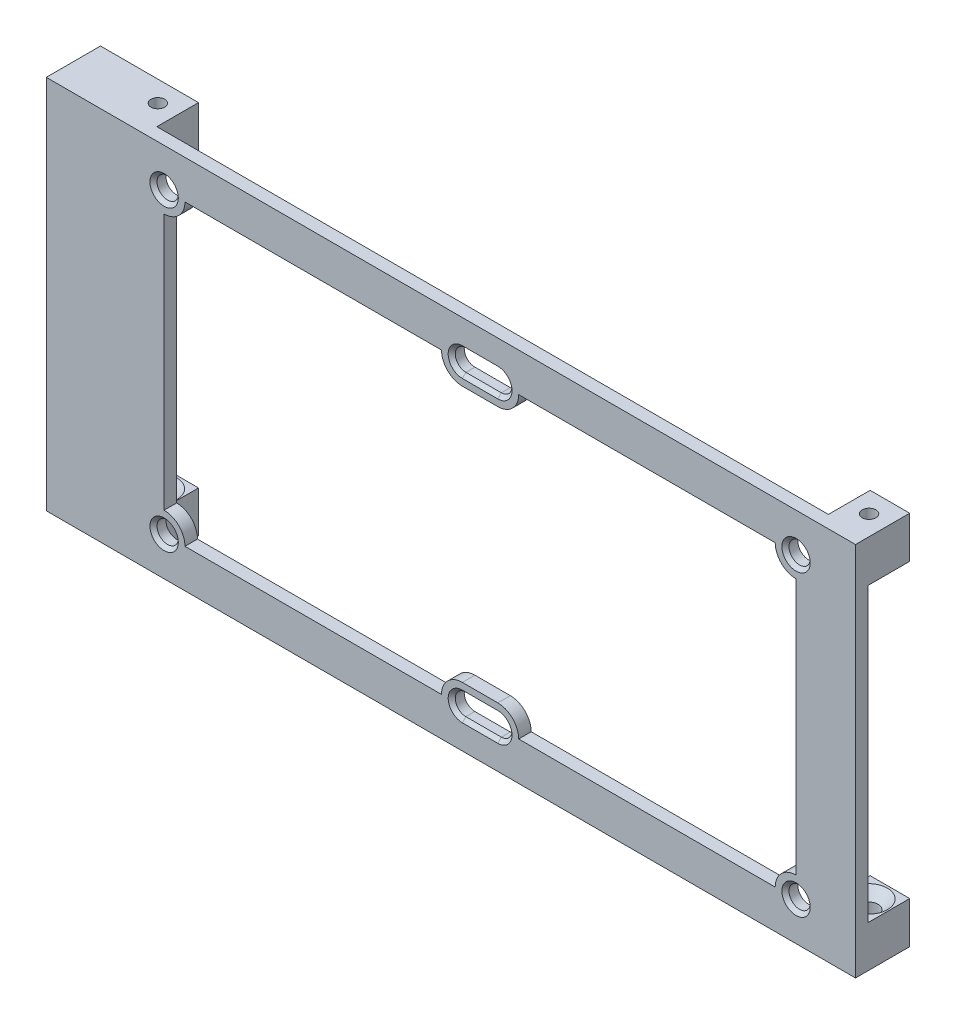
from build123d import *

# Parameters (mm, degrees)
SKETCH3_W                                      = 180
SKETCH3_H                                      = 90
BOSS_EXTRUDE3_DEPTH                            = 3
SKETCH4_W                                      = 8.5
SKETCH4_H                                      = 61.5
CUT_EXTRUDE1_DEPTH                             = 3
CSK_FOR_M5_FLAT_HEAD_MACHINE_SCREW1_AT_2_COUNT = 2
CSK_FOR_M5_FLAT_HEAD_MACHINE_SCREW1_AT_2_PITCH = 167.524625056
CSK_FOR_M5_FLAT_HEAD_MACHINE_SCREW1_AT_3_COUNT = 2
CSK_FOR_M5_FLAT_HEAD_MACHINE_SCREW1_AT_3_PITCH = 71.5
CSK_FOR_M5_FLAT_HEAD_MACHINE_SCREW1_AT_4_COUNT = 2
CSK_FOR_M5_FLAT_HEAD_MACHINE_SCREW1_AT_4_PITCH = 151.5
CSK_SLOT_FOR_M5_FLAT_HEAD_MACHINE_SCREW1_DEPTH = 3
SKETCH12_W                                     = 9.5
SKETCH12_H                                     = 10
BOSS_EXTRUDE4_DEPTH                            = 10
CSK_FOR_M4_SFHCS1_D                            = 4.5
CSK_FOR_M4_SFHCS1_DEPTH                        = 10
CSK_FOR_M4_SFHCS1_CSINK_D                      = 8.96
CSK_FOR_M4_SFHCS1_CSINK_ANGLE                  = 90
M4X0_7_TAPPED_HOLE1_D                          = 3.3
BOSS_EXTRUDE5_DEPTH                            = 14


with BuildPart() as part:
    # Sketch3 → Boss-Extrude3 (new body)
    with BuildSketch(Plane.XY):
        Rectangle(SKETCH3_W, SKETCH3_H)
    extrude(amount=BOSS_EXTRUDE3_DEPTH)

    # Sketch4 → Cut-Extrude1 (cut)
    with BuildSketch(Plane.XY.offset(3)):
        with BuildLine():
            Line((-4.25, -30.75), (-4.25, 30.75))
            ThreePointArc((-4.25, 30.75), (-7.785533906, 32.214466094), (-9.25, 35.75))
            Line((-9.25, 35.75), (-70.75, 35.75))
            ThreePointArc((-70.75, 35.75), (-72.214466094, 32.214466094), (-75.75, 30.75))
            Line((-75.75, 30.75), (-75.75, -30.75))
            ThreePointArc((-75.75, -30.75), (-72.214466094, -32.214466094), (-70.75, -35.75))
            Line((-70.75, -35.75), (-9.25, -35.75))
            ThreePointArc((-9.25, -35.75), (-7.785533906, -32.214466094), (-4.25, -30.75))
        make_face()
        Rectangle(SKETCH4_W, SKETCH4_H)
        with BuildLine():
            ThreePointArc((9.25, 35.75), (7.785533906, 32.214466094), (4.25, 30.75))
            Line((4.25, 30.75), (4.25, -30.75))
            ThreePointArc((4.25, -30.75), (7.785533906, -32.214466094), (9.25, -35.75))
            Line((9.25, -35.75), (70.75, -35.75))
            ThreePointArc((70.75, -35.75), (72.214466094, -32.214466094), (75.75, -30.75))
            Line((75.75, -30.75), (75.75, 30.75))
            ThreePointArc((75.75, 30.75), (72.214466094, 32.214466094), (70.75, 35.75))
            Line((70.75, 35.75), (9.25, 35.75))
        make_face()
    extrude(amount=-CUT_EXTRUDE1_DEPTH, mode=Mode.SUBTRACT)

    # Sketch8 → CSK for M5 Flat Head Machine Screw1 (revolve, cut)
    with BuildSketch(Plane(origin=(-75.75, 35.75, 3), x_dir=(0, -1, 0), z_dir=(1, 0, 0))):
        Polygon((0, 0), (0, 3), (2.55, 3), (2.55, 0.85), (3.4, 0), align=None)
    csk_for_m5_flat_head_machine_screw1 = revolve(axis=Axis((-75.75, 35.75, 9.35), (0, 0, -1)), mode=Mode.SUBTRACT)

    # CSK for M5 Flat Head Machine Screw1 at 2: CSK for M5 Flat Head Machine Screw1 ×2
    with Locations(*[Vector(0.9043446594777974, -0.4268029251000826, 0) * (i * CSK_FOR_M5_FLAT_HEAD_MACHINE_SCREW1_AT_2_PITCH) for i in range(1, CSK_FOR_M5_FLAT_HEAD_MACHINE_SCREW1_AT_2_COUNT)]):
        add(csk_for_m5_flat_head_machine_screw1, mode=Mode.SUBTRACT)

    # CSK for M5 Flat Head Machine Screw1 at 3: CSK for M5 Flat Head Machine Screw1 ×2
    with Locations(*[(0, -i * CSK_FOR_M5_FLAT_HEAD_MACHINE_SCREW1_AT_3_PITCH, 0) for i in range(1, CSK_FOR_M5_FLAT_HEAD_MACHINE_SCREW1_AT_3_COUNT)]):
        add(csk_for_m5_flat_head_machine_screw1, mode=Mode.SUBTRACT)

    # CSK for M5 Flat Head Machine Screw1 at 4: CSK for M5 Flat Head Machine Screw1 ×2
    with Locations(*[(i * CSK_FOR_M5_FLAT_HEAD_MACHINE_SCREW1_AT_4_PITCH, 0, 0) for i in range(1, CSK_FOR_M5_FLAT_HEAD_MACHINE_SCREW1_AT_4_COUNT)]):
        add(csk_for_m5_flat_head_machine_screw1, mode=Mode.SUBTRACT)

    # CSK SLOT for M5 Flat Head Machine Screw1: read off the stored shape, not the designer's step
    # CSK SLOT for M5 Flat Head Machine Sc 2 → CSK SLOT for M5 Flat Head Machine Screw1 (cut)
    with BuildSketch(Plane.XY):
        with BuildLine():
            Line((-4.25, 33.2), (4.25, 33.2))
            ThreePointArc((4.25, 33.2), (6.8, 35.75), (4.25, 38.3))
            Line((4.25, 38.3), (-4.25, 38.3))
            ThreePointArc((-4.25, 38.3), (-6.8, 35.75), (-4.25, 33.2))
        make_face()
        with BuildLine():
            Line((-4.25, -38.3), (4.25, -38.3))
            ThreePointArc((4.25, -38.3), (6.8, -35.75), (4.25, -33.2))
            Line((4.25, -33.2), (-4.25, -33.2))
            ThreePointArc((-4.25, -33.2), (-6.8, -35.75), (-4.25, -38.3))
        make_face()
    extrude(amount=CSK_SLOT_FOR_M5_FLAT_HEAD_MACHINE_SCREW1_DEPTH, mode=Mode.SUBTRACT)

    # CSK SLOT for M5 Flat Head Machine Sc 3: loft between two sections, ruled curve by curve
    csk_slot_for_m5_flat_head_machine_sc_3_from = [
        Edge.make_three_point_arc((4.25, 33.2, 2.15), (6.053122292, 33.946877708, 2.15), (6.8, 35.75, 2.15)),
        Edge.make_three_point_arc((6.8, 35.75, 2.15), (6.053122292, 37.553122292, 2.15), (4.25, 38.3, 2.15)),
        Edge.make_three_point_arc((-4.25, 38.3, 2.15), (-6.053122292, 37.553122292, 2.15), (-6.8, 35.75, 2.15)),
        Edge.make_three_point_arc((-6.8, 35.75, 2.15), (-6.053122292, 33.946877708, 2.15), (-4.25, 33.2, 2.15)),
        Edge.make_line((4.25, 38.3, 2.15), (-4.25, 38.3, 2.15)),
        Edge.make_line((4.25, 33.2, 2.15), (-4.25, 33.2, 2.15)),
    ]
    csk_slot_for_m5_flat_head_machine_sc_3_to = [
        Edge.make_three_point_arc((4.25, 32.35, 3), (6.654163056, 33.345836944, 3), (7.65, 35.75, 3)),
        Edge.make_three_point_arc((7.65, 35.75, 3), (6.654163056, 38.154163056, 3), (4.25, 39.15, 3)),
        Edge.make_three_point_arc((-4.25, 39.15, 3), (-6.654163056, 38.154163056, 3), (-7.65, 35.75, 3)),
        Edge.make_three_point_arc((-7.65, 35.75, 3), (-6.654163056, 33.345836944, 3), (-4.25, 32.35, 3)),
        Edge.make_line((4.25, 39.15, 3), (-4.25, 39.15, 3)),
        Edge.make_line((4.25, 32.35, 3), (-4.25, 32.35, 3)),
    ]
    csk_slot_for_m5_flat_head_machine_sc_3 = Solid(Shell([*[Face.make_surface_from_curves(csk_slot_for_m5_flat_head_machine_sc_3_from[k], csk_slot_for_m5_flat_head_machine_sc_3_to[k]) for k in range(6)], Face(Wire(csk_slot_for_m5_flat_head_machine_sc_3_from)), Face(Wire(csk_slot_for_m5_flat_head_machine_sc_3_to))]))
    add(csk_slot_for_m5_flat_head_machine_sc_3, mode=Mode.SUBTRACT)

    # CSK SLOT for M5 Flat Head Machine Sc 4: loft between two sections, ruled curve by curve
    csk_slot_for_m5_flat_head_machine_sc_4_from = [
        Edge.make_three_point_arc((4.25, -38.3, 2.15), (6.053122292, -37.553122292, 2.15), (6.8, -35.75, 2.15)),
        Edge.make_three_point_arc((6.8, -35.75, 2.15), (6.053122292, -33.946877708, 2.15), (4.25, -33.2, 2.15)),
        Edge.make_three_point_arc((-4.25, -33.2, 2.15), (-6.053122292, -33.946877708, 2.15), (-6.8, -35.75, 2.15)),
        Edge.make_three_point_arc((-6.8, -35.75, 2.15), (-6.053122292, -37.553122292, 2.15), (-4.25, -38.3, 2.15)),
        Edge.make_line((4.25, -33.2, 2.15), (-4.25, -33.2, 2.15)),
        Edge.make_line((4.25, -38.3, 2.15), (-4.25, -38.3, 2.15)),
    ]
    csk_slot_for_m5_flat_head_machine_sc_4_to = [
        Edge.make_three_point_arc((4.25, -39.15, 3), (6.654163056, -38.154163056, 3), (7.65, -35.75, 3)),
        Edge.make_three_point_arc((7.65, -35.75, 3), (6.654163056, -33.345836944, 3), (4.25, -32.35, 3)),
        Edge.make_three_point_arc((-4.25, -32.35, 3), (-6.654163056, -33.345836944, 3), (-7.65, -35.75, 3)),
        Edge.make_three_point_arc((-7.65, -35.75, 3), (-6.654163056, -38.154163056, 3), (-4.25, -39.15, 3)),
        Edge.make_line((4.25, -32.35, 3), (-4.25, -32.35, 3)),
        Edge.make_line((4.25, -39.15, 3), (-4.25, -39.15, 3)),
    ]
    csk_slot_for_m5_flat_head_machine_sc_4 = Solid(Shell([*[Face.make_surface_from_curves(csk_slot_for_m5_flat_head_machine_sc_4_from[k], csk_slot_for_m5_flat_head_machine_sc_4_to[k]) for k in range(6)], Face(Wire(csk_slot_for_m5_flat_head_machine_sc_4_from)), Face(Wire(csk_slot_for_m5_flat_head_machine_sc_4_to))]))
    add(csk_slot_for_m5_flat_head_machine_sc_4, mode=Mode.SUBTRACT)

    # Sketch12 → Boss-Extrude4 (add)
    with BuildSketch(Plane(origin=(0, 0, 0), x_dir=(-1, 0, 0), z_dir=(0, 0, -1))):
        with Locations((-85.25, 40)):
            Rectangle(SKETCH12_W, SKETCH12_H)
        with Locations((-85.25, -40)):
            Rectangle(SKETCH12_W, SKETCH12_H)
    boss_extrude4 = extrude(amount=BOSS_EXTRUDE4_DEPTH)

    # CSK for M4 SFHCS1
    with Locations(Plane(origin=(0, -35, 0), x_dir=(1, 0, 0), z_dir=(0, 1, 0))):
        with Locations((85.162636167, 5)):
            csk_for_m4_sfhcs1 = CounterSinkHole(CSK_FOR_M4_SFHCS1_D / 2, CSK_FOR_M4_SFHCS1_CSINK_D / 2, depth=CSK_FOR_M4_SFHCS1_DEPTH, counter_sink_angle=CSK_FOR_M4_SFHCS1_CSINK_ANGLE)

    # M4x0.7 Tapped Hole1 (through all)
    with Locations(Plane(origin=(0, 45, 0), x_dir=(1, 0, 0), z_dir=(0, 1, 0))):
        with Locations((85.25, 5)):
            m4x0_7_tapped_hole1 = Hole(M4X0_7_TAPPED_HOLE1_D / 2)

    # Mirror1: Boss-Extrude4, CSK for M4 SFHCS1, M4x0.7 Tapped Hole1 across plane
    add(boss_extrude4.mirror(Plane(origin=(0, 0, 0), x_dir=(0, 0, 1), z_dir=(1, 0, 0))))
    add(csk_for_m4_sfhcs1.mirror(Plane(origin=(0, 0, 0), x_dir=(0, 0, 1), z_dir=(1, 0, 0))), mode=Mode.SUBTRACT)
    add(m4x0_7_tapped_hole1.mirror(Plane(origin=(0, 0, 0), x_dir=(0, 0, 1), z_dir=(1, 0, 0))), mode=Mode.SUBTRACT)

    # Sketch20 → Boss-Extrude5 (add)
    with BuildSketch(Plane.ZY.offset(90)):
        Polygon((3, -45), (3, 45), (-10, 45), (-10, 35), (0, 35), (0, -35), (-10, -35), (-10, -45), align=None)
    extrude(amount=BOSS_EXTRUDE5_DEPTH)


solid = part.part
